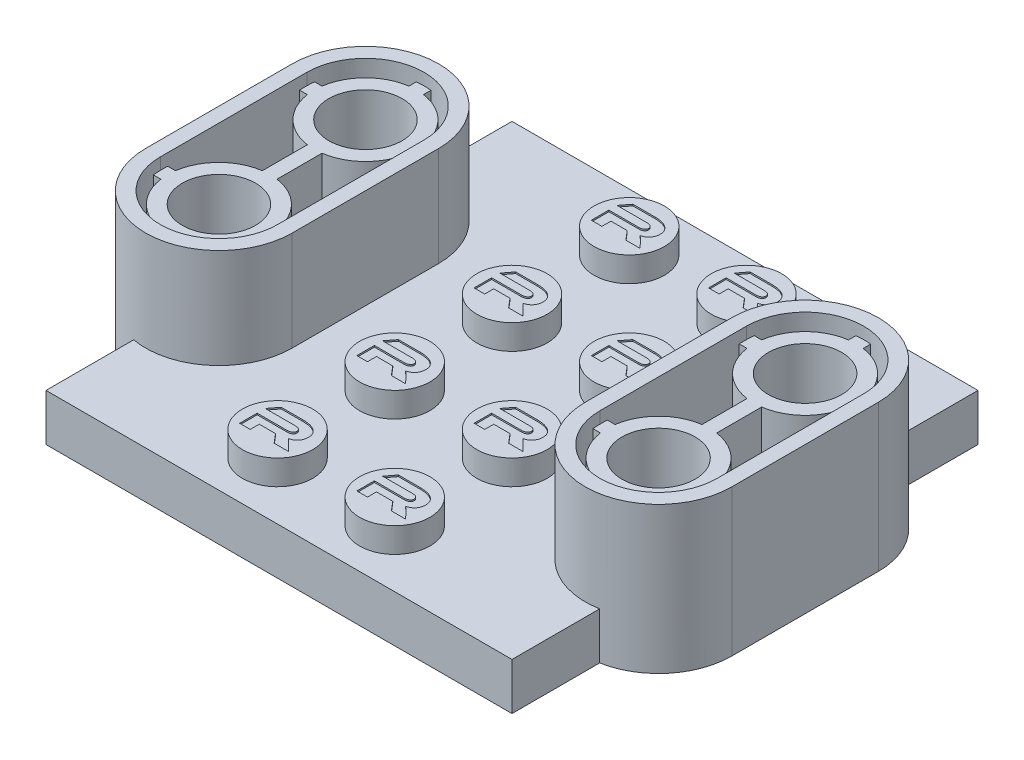
from build123d import *
from build123d.topology import SkipClean

# Parameters (mm, degrees)
SKETCH1_R              = 2.4
BOSS_EXTRUDE1_DEPTH    = 1.7
BOSS_EXTRUDE1_2_DEPTH  = 1.7
BOSS_EXTRUDE1_3_DEPTH  = 1.7
BOSS_EXTRUDE1_4_DEPTH  = 1.7
BOSS_EXTRUDE1_5_DEPTH  = 1.7
BOSS_EXTRUDE1_6_DEPTH  = 1.7
BOSS_EXTRUDE1_7_DEPTH  = 1.7
BOSS_EXTRUDE1_8_DEPTH  = 1.7
BOSS_EXTRUDE1_9_DEPTH  = 1.7
BOSS_EXTRUDE1_10_DEPTH = 1.7
BOSS_EXTRUDE1_11_DEPTH = 1.7
BOSS_EXTRUDE1_12_DEPTH = 1.7
BOSS_EXTRUDE1_13_DEPTH = 1.7
BOSS_EXTRUDE1_14_DEPTH = 1.7
BOSS_EXTRUDE1_15_DEPTH = 1.7
BOSS_EXTRUDE1_16_DEPTH = 1.7
SKETCH2_W              = 31.8
SKETCH2_H              = 31.8
BOSS_EXTRUDE2_DEPTH    = 3.2
SKETCH4_R              = 2.4
CUT_EXTRUDE1_DEPTH     = 8.2
BOSS_EXTRUDE3_DEPTH    = 3.2
SKETCH6_R              = 3.5
CUT_EXTRUDE2_DEPTH     = 2.1
SKETCH7_R              = 2.5
CUT_EXTRUDE3_DEPTH     = 13.5
SKETCH8_R              = 3.5
CUT_EXTRUDE4_DEPTH     = 0.8
SKETCH9_R              = 3.5
SKETCH9_R_2            = 2.5
BOSS_EXTRUDE4_DEPTH    = 6
BOSS_EXTRUDE5_DEPTH    = 6.8
SKETCH11_R             = 4
CUT_EXTRUDE5_DEPTH     = 10
BOSS_EXTRUDE6_DEPTH    = 2.1
SKETCH14_R             = 2.5
BOSS_EXTRUDE7_DEPTH    = 1.3
SKETCH15_R             = 2.4
CUT_EXTRUDE6_DEPTH     = 7
SKETCH16_R             = 3.256854249
SKETCH16_R_2           = 2.556854249
BOSS_EXTRUDE8_DEPTH    = 2.1
SKETCH17_R             = 1.1
CUT_EXTRUDE7_DEPTH     = 1.8
CUT_EXTRUDE8_START     = -2.1
SKETCH18_R             = 2.556854249
CUT_EXTRUDE8_DEPTH     = 2.1
CUT_EXTRUDE9_DEPTH     = 0.1
LPATTERN1_COUNT        = 2
LPATTERN1_PITCH        = 8
LPATTERN1_COUNT_DIR2   = 4
LPATTERN1_PITCH_DIR2   = 8


with BuildPart() as part:
    # Sketch1 → Boss-Extrude1 (new body)
    with BuildSketch(Plane(origin=(0, 0, 0), x_dir=(1, 0, 0), z_dir=(0, 1, 0))):
        with Locations(Location((12, 12, 0), (0, 0, 270))):
            Circle(SKETCH1_R)
    extrude(amount=BOSS_EXTRUDE1_DEPTH)



with BuildPart() as body_2:
    # Sketch1 → Boss-Extrude1 2 (new body)
    with BuildSketch(Plane(origin=(0, 0, 0), x_dir=(1, 0, 0), z_dir=(0, 1, 0))):
        with Locations(Location((4, 12, 0), (0, 0, 270))):
            Circle(SKETCH1_R)
    extrude(amount=BOSS_EXTRUDE1_2_DEPTH)


with BuildPart() as body_3:
    # Sketch1 → Boss-Extrude1 3 (new body)
    with BuildSketch(Plane(origin=(0, 0, 0), x_dir=(1, 0, 0), z_dir=(0, 1, 0))):
        with Locations(Location((-4, 12, 0), (0, 0, 270))):
            Circle(SKETCH1_R)
    extrude(amount=BOSS_EXTRUDE1_3_DEPTH)


with BuildPart() as body_4:
    # Sketch1 → Boss-Extrude1 4 (new body)
    with BuildSketch(Plane(origin=(0, 0, 0), x_dir=(1, 0, 0), z_dir=(0, 1, 0))):
        with Locations(Location((-12, 12, 0), (0, 0, 270))):
            Circle(SKETCH1_R)
    extrude(amount=BOSS_EXTRUDE1_4_DEPTH)


with BuildPart() as body_5:
    # Sketch1 → Boss-Extrude1 5 (new body)
    with BuildSketch(Plane(origin=(0, 0, 0), x_dir=(1, 0, 0), z_dir=(0, 1, 0))):
        with Locations(Location((4, 4, 0), (0, 0, 270))):
            Circle(SKETCH1_R)
    extrude(amount=BOSS_EXTRUDE1_5_DEPTH)


with BuildPart() as body_6:
    # Sketch1 → Boss-Extrude1 6 (new body)
    with BuildSketch(Plane(origin=(0, 0, 0), x_dir=(1, 0, 0), z_dir=(0, 1, 0))):
        with Locations(Location((-4, 4, 0), (0, 0, 270))):
            Circle(SKETCH1_R)
    extrude(amount=BOSS_EXTRUDE1_6_DEPTH)


with BuildPart() as body_7:
    # Sketch1 → Boss-Extrude1 7 (new body)
    with BuildSketch(Plane(origin=(0, 0, 0), x_dir=(1, 0, 0), z_dir=(0, 1, 0))):
        with Locations(Location((-12, 4, 0), (0, 0, 270))):
            Circle(SKETCH1_R)
    extrude(amount=BOSS_EXTRUDE1_7_DEPTH)


with BuildPart() as body_8:
    # Sketch1 → Boss-Extrude1 8 (new body)
    with BuildSketch(Plane(origin=(0, 0, 0), x_dir=(1, 0, 0), z_dir=(0, 1, 0))):
        with Locations(Location((4, -4, 0), (0, 0, 270))):
            Circle(SKETCH1_R)
    extrude(amount=BOSS_EXTRUDE1_8_DEPTH)


with BuildPart() as body_9:
    # Sketch1 → Boss-Extrude1 9 (new body)
    with BuildSketch(Plane(origin=(0, 0, 0), x_dir=(1, 0, 0), z_dir=(0, 1, 0))):
        with Locations(Location((-4, -4, 0), (0, 0, 270))):
            Circle(SKETCH1_R)
    extrude(amount=BOSS_EXTRUDE1_9_DEPTH)


with BuildPart() as body_10:
    # Sketch1 → Boss-Extrude1 10 (new body)
    with BuildSketch(Plane(origin=(0, 0, 0), x_dir=(1, 0, 0), z_dir=(0, 1, 0))):
        with Locations(Location((-12, -4, 0), (0, 0, 270))):
            Circle(SKETCH1_R)
    extrude(amount=BOSS_EXTRUDE1_10_DEPTH)


with BuildPart() as body_11:
    # Sketch1 → Boss-Extrude1 11 (new body)
    with BuildSketch(Plane(origin=(0, 0, 0), x_dir=(1, 0, 0), z_dir=(0, 1, 0))):
        with Locations(Location((4, -12, 0), (0, 0, 270))):
            Circle(SKETCH1_R)
    extrude(amount=BOSS_EXTRUDE1_11_DEPTH)


with BuildPart() as body_12:
    # Sketch1 → Boss-Extrude1 12 (new body)
    with BuildSketch(Plane(origin=(0, 0, 0), x_dir=(1, 0, 0), z_dir=(0, 1, 0))):
        with Locations(Location((-4, -12, 0), (0, 0, 270))):
            Circle(SKETCH1_R)
    extrude(amount=BOSS_EXTRUDE1_12_DEPTH)


with BuildPart() as body_13:
    # Sketch1 → Boss-Extrude1 13 (new body)
    with BuildSketch(Plane(origin=(0, 0, 0), x_dir=(1, 0, 0), z_dir=(0, 1, 0))):
        with Locations(Location((-12, -12, 0), (0, 0, 270))):
            Circle(SKETCH1_R)
    extrude(amount=BOSS_EXTRUDE1_13_DEPTH)


with BuildPart() as body_14:
    # Sketch1 → Boss-Extrude1 14 (new body)
    with BuildSketch(Plane(origin=(0, 0, 0), x_dir=(1, 0, 0), z_dir=(0, 1, 0))):
        with Locations(Location((12, 4, 0), (0, 0, 270))):
            Circle(SKETCH1_R)
    extrude(amount=BOSS_EXTRUDE1_14_DEPTH)


with BuildPart() as body_15:
    # Sketch1 → Boss-Extrude1 15 (new body)
    with BuildSketch(Plane(origin=(0, 0, 0), x_dir=(1, 0, 0), z_dir=(0, 1, 0))):
        with Locations(Location((12, -4, 0), (0, 0, 270))):
            Circle(SKETCH1_R)
    extrude(amount=BOSS_EXTRUDE1_15_DEPTH)


with BuildPart() as body_16:
    # Sketch1 → Boss-Extrude1 16 (new body)
    with BuildSketch(Plane(origin=(0, 0, 0), x_dir=(1, 0, 0), z_dir=(0, 1, 0))):
        with Locations(Location((12, -12, 0), (0, 0, 270))):
            Circle(SKETCH1_R)
    extrude(amount=BOSS_EXTRUDE1_16_DEPTH)


with BuildPart() as part_1:
    add(part.part)

    add(body_2.part)  # Boss-Extrude2 merges body 2

    add(body_3.part)  # Boss-Extrude2 merges body 3

    add(body_4.part)  # Boss-Extrude2 merges body 4

    add(body_5.part)  # Boss-Extrude2 merges body 5

    add(body_6.part)  # Boss-Extrude2 merges body 6

    add(body_7.part)  # Boss-Extrude2 merges body 7

    add(body_8.part)  # Boss-Extrude2 merges body 8

    add(body_9.part)  # Boss-Extrude2 merges body 9

    add(body_10.part)  # Boss-Extrude2 merges body 10

    add(body_11.part)  # Boss-Extrude2 merges body 11

    add(body_12.part)  # Boss-Extrude2 merges body 12

    add(body_13.part)  # Boss-Extrude2 merges body 13

    add(body_14.part)  # Boss-Extrude2 merges body 14

    add(body_15.part)  # Boss-Extrude2 merges body 15

    add(body_16.part)  # Boss-Extrude2 merges body 16
    # Sketch2 → Boss-Extrude2 (add)
    with BuildSketch(Plane(origin=(0, 0, 0), x_dir=(1, 0, 0), z_dir=(0, 1, 0))):
        Rectangle(SKETCH2_W, SKETCH2_H)
    extrude(amount=-BOSS_EXTRUDE2_DEPTH)

    # Sketch4 → Cut-Extrude1 (cut)
    with BuildSketch(Plane(origin=(0, 0, 0), x_dir=(1, 0, 0), z_dir=(0, 1, 0))):
        with Locations((12, -4)):
            Circle(SKETCH4_R)
        with Locations((12, 4)):
            Circle(SKETCH4_R)
        with Locations((-12, -4)):
            Circle(SKETCH4_R)
        with Locations((-12, 4)):
            Circle(SKETCH4_R)
    extrude(amount=CUT_EXTRUDE1_DEPTH, mode=Mode.SUBTRACT)

    # Sketch5 → Boss-Extrude3 (add)
    with BuildSketch(Plane.XZ.offset(3.2)):
        with BuildLine():
            ThreePointArc((-15.9, 9.918333051), (-18.840572874, 8.201562119), (-20, 5))
            ThreePointArc((-20, 5), (-18.840572874, 1.798437881), (-15.9, 0.081666949))
            Line((-15.9, 0.081666949), (-15.9, 9.918333051))
        make_face()
        with BuildLine():
            ThreePointArc((-10, 5), (-11.798437881, 8.840572874), (-15.9, 9.918333051))
            Line((-15.9, 9.918333051), (-15.9, 0.081666949))
            ThreePointArc((-15.9, 0.081666949), (-15.451848838, 0.020458593), (-15, 0))
            ThreePointArc((-15, 0), (-11.464466094, 1.464466094), (-10, 5))
        make_face()
        with BuildLine():
            ThreePointArc((-15.9, 0.081666949), (-18.840572874, 1.798437881), (-20, 5))
            Line((-20, 5), (-20, -5))
            ThreePointArc((-20, -5), (-18.840572874, -1.798437881), (-15.9, -0.081666949))
            Line((-15.9, -0.081666949), (-15.9, 0.081666949))
        make_face()
        with BuildLine():
            ThreePointArc((-15.9, -0.081666949), (-18.840572874, -1.798437881), (-20, -5))
            ThreePointArc((-20, -5), (-18.840572874, -8.201562119), (-15.9, -9.918333051))
            Line((-15.9, -9.918333051), (-15.9, -0.081666949))
        make_face()
        with BuildLine():
            ThreePointArc((-15, 0), (-15.451848838, -0.020458593), (-15.9, -0.081666949))
            Line((-15.9, -0.081666949), (-15.9, -9.918333051))
            ThreePointArc((-15.9, -9.918333051), (-11.798437881, -8.840572874), (-10, -5))
            ThreePointArc((-10, -5), (-11.464466094, -1.464466094), (-15, 0))
        make_face()
        with BuildLine():
            ThreePointArc((15.9, 0.081666949), (18.840572874, 1.798437881), (20, 5))
            ThreePointArc((20, 5), (18.840572874, 8.201562119), (15.9, 9.918333051))
            Line((15.9, 9.918333051), (15.9, 0.081666949))
        make_face()
        with BuildLine():
            Line((15.9, 0.081666949), (15.9, 9.918333051))
            ThreePointArc((15.9, 9.918333051), (10.020458593, 5.451848845), (14.999999987, 0))
            ThreePointArc((14.999999987, 0), (15.451848832, 0.020458592), (15.9, 0.081666949))
        make_face()
        with BuildLine():
            Line((20, -5), (20, 5))
            ThreePointArc((20, 5), (18.840572874, 1.798437881), (15.9, 0.081666949))
            Line((15.9, 0.081666949), (15.9, -0.081666949))
            ThreePointArc((15.9, -0.081666949), (18.840572874, -1.798437881), (20, -5))
        make_face()
        with BuildLine():
            ThreePointArc((15.9, -9.918333051), (18.840572874, -8.201562119), (20, -5))
            ThreePointArc((20, -5), (18.840572874, -1.798437881), (15.9, -0.081666949))
            Line((15.9, -0.081666949), (15.9, -9.918333051))
        make_face()
        with BuildLine():
            Line((15.9, -9.918333051), (15.9, -0.081666949))
            ThreePointArc((15.9, -0.081666949), (15.451848832, -0.020458592), (14.999999987, 0))
            ThreePointArc((14.999999987, 0), (10.020458593, -5.451848845), (15.9, -9.918333051))
        make_face()
    extrude(amount=-BOSS_EXTRUDE3_DEPTH)

    # Sketch6 → Cut-Extrude2 (cut)
    with BuildSketch(Plane.XZ.offset(3.2)):
        with BuildLine():
            Line((-19, 5), (-19, -5))
            ThreePointArc((-19, -5), (-17.792848009, -7.863564213), (-14.9, -8.998749805))
            Line((-14.9, -8.998749805), (-14.9, -14.9))
            Line((-14.9, -14.9), (14.9, -14.9))
            Line((14.9, -14.9), (14.9, -8.998749805))
            ThreePointArc((14.9, -8.998749805), (17.792848009, -7.863564213), (19, -5))
            Line((19, -5), (19, 5))
            ThreePointArc((19, 5), (17.792848009, 7.863564213), (14.9, 8.998749805))
            Line((14.9, 8.998749805), (14.9, 14.9))
            Line((14.9, 14.9), (-14.9, 14.9))
            Line((-14.9, 14.9), (-14.9, 8.998749805))
            ThreePointArc((-14.9, 8.998749805), (-17.792848009, 7.863564213), (-19, 5))
        make_face()
        with Locations(Location((-15, 5, 0), (0, 0, 270))):
            Circle(SKETCH6_R, mode=Mode.SUBTRACT)
        with Locations(Location((15, 5, 0), (0, 0, 270))):
            Circle(SKETCH6_R, mode=Mode.SUBTRACT)
        with Locations(Location((15, -5, 0), (0, 0, 270))):
            Circle(SKETCH6_R, mode=Mode.SUBTRACT)
        with Locations(Location((-15, -5, 0), (0, 0, 270))):
            Circle(SKETCH6_R, mode=Mode.SUBTRACT)
    extrude(amount=-CUT_EXTRUDE2_DEPTH, mode=Mode.SUBTRACT)

    # Sketch7 → Cut-Extrude3 (cut)
    with BuildSketch(Plane.XZ.offset(3.2)):
        with Locations(Location((-15, 5, 0), (0, 0, 270))):
            Circle(SKETCH7_R)
        with Locations(Location((-15, -5, 0), (0, 0, 270))):
            Circle(SKETCH7_R)
        with Locations(Location((15, -5, 0), (0, 0, 270))):
            Circle(SKETCH7_R)
        with Locations(Location((15, 5, 0), (0, 0, 270))):
            Circle(SKETCH7_R)
    extrude(amount=-CUT_EXTRUDE3_DEPTH, mode=Mode.SUBTRACT)

    # Sketch8 → Cut-Extrude4 (cut)
    with BuildSketch(Plane.XZ.offset(3.2)):
        with Locations(Location((-15, -5, 0), (0, 0, 270))):
            Circle(SKETCH8_R)
        with Locations(Location((15, -5, 0), (0, 0, 270))):
            Circle(SKETCH8_R)
        with Locations(Location((15, 5, 0), (0, 0, 270))):
            Circle(SKETCH8_R)
        with Locations(Location((-15, 5, 0), (0, 0, 270))):
            Circle(SKETCH8_R)
    extrude(amount=-CUT_EXTRUDE4_DEPTH, mode=Mode.SUBTRACT)

    # Sketch9 → Boss-Extrude4 (add)
    # profile 1 of 4: a face of its own
    with BuildSketch(Plane(origin=(0, 0, 0), x_dir=(1, 0, 0), z_dir=(0, 1, 0))):
        with Locations(Location((15, 5, 0), (0, 0, 90))):
            Circle(SKETCH9_R)
        with Locations(Location((15, 5, 0), (0, 0, 90))):
            Circle(SKETCH9_R_2, mode=Mode.SUBTRACT)
    # profile 2 of 4: a face of its own
    with BuildSketch(Plane(origin=(0, 0, 0), x_dir=(1, 0, 0), z_dir=(0, 1, 0))):
        with Locations(Location((15, -5, 0), (0, 0, 90))):
            Circle(SKETCH9_R)
        with Locations(Location((15, -5, 0), (0, 0, 90))):
            Circle(SKETCH9_R_2, mode=Mode.SUBTRACT)
    # profile 3 of 4: a face of its own
    with BuildSketch(Plane(origin=(0, 0, 0), x_dir=(1, 0, 0), z_dir=(0, 1, 0))):
        with Locations(Location((-15, -5, 0), (0, 0, 90))):
            Circle(SKETCH9_R)
        with Locations(Location((-15, -5, 0), (0, 0, 90))):
            Circle(SKETCH9_R_2, mode=Mode.SUBTRACT)
    # profile 4 of 4: a face of its own
    with BuildSketch(Plane(origin=(0, 0, 0), x_dir=(1, 0, 0), z_dir=(0, 1, 0))):
        with Locations(Location((-15, 5, 0), (0, 0, 90))):
            Circle(SKETCH9_R)
        with Locations(Location((-15, 5, 0), (0, 0, 90))):
            Circle(SKETCH9_R_2, mode=Mode.SUBTRACT)
    extrude(amount=BOSS_EXTRUDE4_DEPTH)

    # Sketch10 → Boss-Extrude5 (add)
    # profile 1 of 8: a face of its own
    with SkipClean():  # the faces are left unmerged after this step: merging them gives an invalid solid
        with BuildSketch(Plane(origin=(0, 0, 0), x_dir=(1, 0, 0), z_dir=(0, 1, 0))):
            with BuildLine():
                ThreePointArc((-15.9, 9.918333051), (-18.840572874, 8.201562119), (-20, 5))
                Line((-20, 5), (-20, -5))
                ThreePointArc((-20, -5), (-18.840572874, -8.201562119), (-15.9, -9.918333051))
                ThreePointArc((-15.9, -9.918333051), (-11.798437881, -8.840572874), (-10, -5))
                Line((-10, -5), (-10, 5))
                ThreePointArc((-10, 5), (-11.798437881, 8.840572874), (-15.9, 9.918333051))
            make_face()
            with BuildLine():
                Line((-19, 4.5), (-19, 5))
                ThreePointArc((-19, 5), (-18.992149037, 5.25049165), (-18.968626967, 5.5))
                ThreePointArc((-18.968626967, 5.5), (-17.828427125, 7.828427125), (-15.5, 8.968626967))
                ThreePointArc((-15.5, 8.968626967), (-15, 9), (-14.5, 8.968626967))
                ThreePointArc((-14.5, 8.968626967), (-12.171572875, 7.828427125), (-11.031373033, 5.5))
                ThreePointArc((-11.031373033, 5.5), (-11.007850963, 5.25049165), (-11, 5))
                Line((-11, 5), (-11, 4.5))
                Line((-11, 4.5), (-11, -4.5))
                Line((-11, -4.5), (-11, -5))
                ThreePointArc((-11, -5), (-11.007850963, -5.25049165), (-11.031373033, -5.5))
                ThreePointArc((-11.031373033, -5.5), (-12.171572875, -7.828427125), (-14.5, -8.968626967))
                ThreePointArc((-14.5, -8.968626967), (-15, -9), (-15.5, -8.968626967))
                ThreePointArc((-15.5, -8.968626967), (-17.828427125, -7.828427125), (-18.968626967, -5.5))
                ThreePointArc((-18.968626967, -5.5), (-18.992149037, -5.25049165), (-19, -5))
                Line((-19, -5), (-19, -4.5))
                Line((-19, -4.5), (-19, 4.5))
            make_face(mode=Mode.SUBTRACT)
        # profile 2 of 8: a face of its own
        with BuildSketch(Plane(origin=(0, 0, 0), x_dir=(1, 0, 0), z_dir=(0, 1, 0))):
            with BuildLine():
                ThreePointArc((-14.5, 8.968626967), (-15, 9), (-15.5, 8.968626967))
                Line((-15.5, 8.968626967), (-15.5, 8.464101615))
                ThreePointArc((-15.5, 8.464101615), (-15, 8.5), (-14.5, 8.464101615))
                Line((-14.5, 8.464101615), (-14.5, 8.968626967))
            make_face()
        # profile 3 of 8: a face of its own
        with BuildSketch(Plane(origin=(0, 0, 0), x_dir=(1, 0, 0), z_dir=(0, 1, 0))):
            with BuildLine():
                ThreePointArc((-11, 5), (-11.007850963, 5.25049165), (-11.031373033, 5.5))
                Line((-11.031373033, 5.5), (-11.535898385, 5.5))
                ThreePointArc((-11.535898385, 5.5), (-11.508986132, 5.250643519), (-11.5, 5))
                ThreePointArc((-11.5, 5), (-11.508986132, 4.749356481), (-11.535898385, 4.5))
                Line((-11.535898385, 4.5), (-11, 4.5))
                Line((-11, 4.5), (-11, 5))
            make_face()
        # profile 4 of 8: a face of its own
        with BuildSketch(Plane(origin=(0, 0, 0), x_dir=(1, 0, 0), z_dir=(0, 1, 0))):
            with BuildLine():
                ThreePointArc((-18.968626967, 5.5), (-18.992149037, 5.25049165), (-19, 5))
                Line((-19, 5), (-19, 4.5))
                Line((-19, 4.5), (-18.464101615, 4.5))
                ThreePointArc((-18.464101615, 4.5), (-18.5, 5), (-18.464101615, 5.5))
                Line((-18.464101615, 5.5), (-18.968626967, 5.5))
            make_face()
        # profile 5 of 8: a face of its own
        with BuildSketch(Plane(origin=(0, 0, 0), x_dir=(1, 0, 0), z_dir=(0, 1, 0))):
            with BuildLine():
                Line((-18.464101615, -4.5), (-19, -4.5))
                Line((-19, -4.5), (-19, -5))
                ThreePointArc((-19, -5), (-18.992149037, -5.25049165), (-18.968626967, -5.5))
                Line((-18.968626967, -5.5), (-18.464101615, -5.5))
                ThreePointArc((-18.464101615, -5.5), (-18.5, -5), (-18.464101615, -4.5))
            make_face()
        # profile 6 of 8: a face of its own
        with BuildSketch(Plane(origin=(0, 0, 0), x_dir=(1, 0, 0), z_dir=(0, 1, 0))):
            with BuildLine():
                Line((-11, -4.5), (-11.535898385, -4.5))
                ThreePointArc((-11.535898385, -4.5), (-11.508986132, -4.749356481), (-11.5, -5))
                ThreePointArc((-11.5, -5), (-11.508986132, -5.250643519), (-11.535898385, -5.5))
                Line((-11.535898385, -5.5), (-11.031373033, -5.5))
                ThreePointArc((-11.031373033, -5.5), (-11.007850963, -5.25049165), (-11, -5))
                Line((-11, -5), (-11, -4.5))
            make_face()
        # profile 7 of 8: a face of its own
        with BuildSketch(Plane(origin=(0, 0, 0), x_dir=(1, 0, 0), z_dir=(0, 1, 0))):
            with BuildLine():
                Line((-15.5, -8.464101615), (-15.5, -8.968626967))
                ThreePointArc((-15.5, -8.968626967), (-15, -9), (-14.5, -8.968626967))
                Line((-14.5, -8.968626967), (-14.5, -8.464101615))
                ThreePointArc((-14.5, -8.464101615), (-15, -8.5), (-15.5, -8.464101615))
            make_face()
        # profile 8 of 8: a face of its own
        with BuildSketch(Plane(origin=(0, 0, 0), x_dir=(1, 0, 0), z_dir=(0, 1, 0))):
            with BuildLine():
                ThreePointArc((-14.5, 1.535898385), (-15, 1.5), (-15.5, 1.535898385))
                Line((-15.5, 1.535898385), (-15.5, -1.535898385))
                ThreePointArc((-15.5, -1.535898385), (-15, -1.5), (-14.5, -1.535898385))
                Line((-14.5, -1.535898385), (-14.5, 1.535898385))
            make_face()
        boss_extrude5 = extrude(amount=BOSS_EXTRUDE5_DEPTH)

    # Mirror1: Boss-Extrude5 across plane
    with SkipClean():  # the faces are left unmerged after this step: merging them gives an invalid solid
        add(boss_extrude5.mirror(Plane(origin=(0, 0, 0), x_dir=(0, 0, 1), z_dir=(1, 0, 0))))

    # Sketch11 → Cut-Extrude5 (cut)
    with SkipClean():  # the faces are left unmerged after this step: merging them gives an invalid solid
        with BuildSketch(Plane(origin=(0, 6, 0), x_dir=(1, 0, 0), z_dir=(0, 1, 0))):
            with BuildLine():
                ThreePointArc((-11, 5), (-15, 9), (-19, 5))
                ThreePointArc((-19, 5), (-15, 1), (-11, 5))
            make_face()
            with Locations((-15, -5)):
                Circle(SKETCH11_R)
            with BuildLine():
                Line((-19, 5), (-19, -5))
                ThreePointArc((-19, -5), (-15, -1), (-11, -5))
                Line((-11, -5), (-11, 5))
                ThreePointArc((-11, 5), (-15, 1), (-19, 5))
            make_face()
            with BuildLine():
                Line((19, -5), (19, 5))
                ThreePointArc((19, 5), (15, 1), (11, 5))
                Line((11, 5), (11, -5))
                ThreePointArc((11, -5), (15, -1), (19, -5))
            make_face()
            with Locations((15, 5)):
                Circle(SKETCH11_R)
            with Locations((15, -5)):
                Circle(SKETCH11_R)
        extrude(amount=CUT_EXTRUDE5_DEPTH, mode=Mode.SUBTRACT)

    # Sketch12 → Boss-Extrude6 (add)
    # profile 1 of 2: a face of its own
    with SkipClean():  # the faces are left unmerged after this step: merging them gives an invalid solid
        with BuildSketch(Plane.XZ.offset(3.2)):
            with BuildLine():
                Line((-10, -5), (-10, 5))
                ThreePointArc((-10, 5), (-15, 10), (-20, 5))
                Line((-20, 5), (-20, -5))
                ThreePointArc((-20, -5), (-15, -10), (-10, -5))
            make_face()
            with BuildLine():
                Line((-19, 5), (-19, -5))
                ThreePointArc((-19, -5), (-15, -9), (-11, -5))
                Line((-11, -5), (-11, 5))
                ThreePointArc((-11, 5), (-15, 9), (-19, 5))
            make_face(mode=Mode.SUBTRACT)
        # profile 2 of 2: a face of its own
        with BuildSketch(Plane.XZ.offset(3.2)):
            with BuildLine():
                Line((10, 5), (10, -5))
                ThreePointArc((10, -5), (15, -10), (20, -5))
                Line((20, -5), (20, 5))
                ThreePointArc((20, 5), (15, 10), (10, 5))
            make_face()
            with BuildLine():
                Line((19, -5), (19, 5))
                ThreePointArc((19, 5), (15, 9), (11, 5))
                Line((11, 5), (11, -5))
                ThreePointArc((11, -5), (15, -9), (19, -5))
            make_face(mode=Mode.SUBTRACT)
        extrude(amount=-BOSS_EXTRUDE6_DEPTH)

    # Sketch14 → Boss-Extrude7 (add)
    with SkipClean():  # the faces are left unmerged after this step: merging them gives an invalid solid
        with BuildSketch(Plane.XZ.offset(2.4)):
            with BuildLine():
                Line((-11.031373033, 5.5), (-11.535898385, 5.5))
                ThreePointArc((-11.535898385, 5.5), (-12.525126266, 7.474873734), (-14.5, 8.464101615))
                Line((-14.5, 8.464101615), (-14.5, 8.968626967))
                ThreePointArc((-14.5, 8.968626967), (-15, 9), (-15.5, 8.968626967))
                Line((-15.5, 8.968626967), (-15.5, 8.464101615))
                ThreePointArc((-15.5, 8.464101615), (-17.474873734, 7.474873734), (-18.464101615, 5.5))
                Line((-18.464101615, 5.5), (-18.968626967, 5.5))
                ThreePointArc((-18.968626967, 5.5), (-18.992149037, 5.25049165), (-19, 5))
                Line((-19, 5), (-19, 4.5))
                Line((-19, 4.5), (-18.464101615, 4.5))
                ThreePointArc((-18.464101615, 4.5), (-17.474873734, 2.525126266), (-15.5, 1.535898385))
                Line((-15.5, 1.535898385), (-15.5, -1.535898385))
                ThreePointArc((-15.5, -1.535898385), (-17.474873734, -2.525126266), (-18.464101615, -4.5))
                Line((-18.464101615, -4.5), (-19, -4.5))
                Line((-19, -4.5), (-19, -5))
                ThreePointArc((-19, -5), (-18.992149037, -5.25049165), (-18.968626967, -5.5))
                Line((-18.968626967, -5.5), (-18.464101615, -5.5))
                ThreePointArc((-18.464101615, -5.5), (-17.474873734, -7.474873734), (-15.5, -8.464101615))
                Line((-15.5, -8.464101615), (-15.5, -8.968626967))
                ThreePointArc((-15.5, -8.968626967), (-15, -9), (-14.5, -8.968626967))
                Line((-14.5, -8.968626967), (-14.5, -8.464101615))
                ThreePointArc((-14.5, -8.464101615), (-12.525126266, -7.474873734), (-11.535898385, -5.5))
                Line((-11.535898385, -5.5), (-11.031373033, -5.5))
                ThreePointArc((-11.031373033, -5.5), (-11.007850963, -5.25049165), (-11, -5))
                Line((-11, -5), (-11, -4.5))
                Line((-11, -4.5), (-11.535898385, -4.5))
                ThreePointArc((-11.535898385, -4.5), (-12.525126266, -2.525126266), (-14.5, -1.535898385))
                Line((-14.5, -1.535898385), (-14.5, 1.535898385))
                ThreePointArc((-14.5, 1.535898385), (-12.525126266, 2.525126266), (-11.535898385, 4.5))
                Line((-11.535898385, 4.5), (-11, 4.5))
                Line((-11, 4.5), (-11, 5))
                ThreePointArc((-11, 5), (-11.007850963, 5.25049165), (-11.031373033, 5.5))
            make_face()
            with Locations(Location((-15, 5, 0), (0, 0, 270))):
                Circle(SKETCH14_R, mode=Mode.SUBTRACT)
            with Locations(Location((-15, -5, 0), (0, 0, 270))):
                Circle(SKETCH14_R, mode=Mode.SUBTRACT)
        boss_extrude7 = extrude(amount=-BOSS_EXTRUDE7_DEPTH)

    # Mirror2: Boss-Extrude7 across plane
    with SkipClean():  # the faces are left unmerged after this step: merging them gives an invalid solid
        add(boss_extrude7.mirror(Plane(origin=(0, 0, 0), x_dir=(0, 0, 1), z_dir=(1, 0, 0))))

    # Sketch15 → Cut-Extrude6 (cut)
    with SkipClean():  # the faces are left unmerged after this step: merging them gives an invalid solid
        with BuildSketch(Plane(origin=(0, 0, 0), x_dir=(1, 0, 0), z_dir=(0, 1, 0))):
            with Locations((12, -12)):
                Circle(SKETCH15_R)
            with Locations((-12, -12)):
                Circle(SKETCH15_R)
            with Locations((-12, 12)):
                Circle(SKETCH15_R)
            with Locations((12, 12)):
                Circle(SKETCH15_R)
        extrude(amount=CUT_EXTRUDE6_DEPTH, mode=Mode.SUBTRACT)

    # Sketch16 → Boss-Extrude8 (add)
    # profile 1 of 7: a face of its own
    with SkipClean():  # the faces are left unmerged after this step: merging them gives an invalid solid
        with BuildSketch(Plane.XZ.offset(1.1)):
            with BuildLine():
                Line((-14.9, 14.9), (-14.9, 9.9989999))
                ThreePointArc((-14.9, 9.9989999), (-11.429285786, 8.5), (-10, 5))
                Line((-10, 5), (-10, 3.515315154))
                ThreePointArc((-10, 3.515315154), (-9.820152229, 4.388881219), (-9.791765012, 5.28031661))
                ThreePointArc((-9.791765012, 5.28031661), (-5.006478603, 9.282937742), (-11.205125912, 8.578158709))
                ThreePointArc((-11.205125912, 8.578158709), (-12.660956861, 9.661884414), (-14.4, 10.181147469))
                Line((-14.4, 10.181147469), (-14.4, 14.4))
                Line((-14.4, 14.4), (14.4, 14.4))
                Line((14.4, 14.4), (14.4, 10.181147469))
                ThreePointArc((14.4, 10.181147469), (12.660956861, 9.661884414), (11.205125912, 8.578158709))
                ThreePointArc((11.205125912, 8.578158709), (5.006478603, 9.282937742), (9.791765012, 5.28031661))
                ThreePointArc((9.791765012, 5.28031661), (9.820152229, 4.388881219), (10, 3.515315154))
                Line((10, 3.515315154), (10, 5))
                ThreePointArc((10, 5), (11.429285786, 8.5), (14.9, 9.9989999))
                Line((14.9, 9.9989999), (14.9, 14.9))
                Line((14.9, 14.9), (-14.9, 14.9))
            make_face()
            with BuildLine():
                ThreePointArc((9.966121544, 6.365414509), (5.649880124, 9.007194233), (10.539611248, 7.703557152))
                ThreePointArc((10.539611248, 7.703557152), (10.205948072, 7.054593683), (9.966121544, 6.365414509))
            make_face(mode=Mode.SUBTRACT)
            with BuildLine():
                ThreePointArc((-10.539611248, 7.703557152), (-5.649880124, 9.007194233), (-9.966121544, 6.365414509))
                ThreePointArc((-9.966121544, 6.365414509), (-10.205948072, 7.054593683), (-10.539611248, 7.703557152))
            make_face(mode=Mode.SUBTRACT)
        # profile 2 of 7: a face of its own
        with BuildSketch(Plane.XZ.offset(1.1)):
            with BuildLine():
                Line((-14.4, -14.4), (-14.4, -10.181147469))
                ThreePointArc((-14.4, -10.181147469), (-12.660956861, -9.661884414), (-11.205125912, -8.578158709))
                ThreePointArc((-11.205125912, -8.578158709), (-5.006478603, -9.282937742), (-9.791765012, -5.28031661))
                ThreePointArc((-9.791765012, -5.28031661), (-9.820152229, -4.388881219), (-10, -3.515315154))
                Line((-10, -3.515315154), (-10, -5))
                ThreePointArc((-10, -5), (-11.429285786, -8.5), (-14.9, -9.9989999))
                Line((-14.9, -9.9989999), (-14.9, -14.9))
                Line((-14.9, -14.9), (14.9, -14.9))
                Line((14.9, -14.9), (14.9, -9.9989999))
                ThreePointArc((14.9, -9.9989999), (11.429285786, -8.5), (10, -5))
                Line((10, -5), (10, -3.515315154))
                ThreePointArc((10, -3.515315154), (9.820152229, -4.388881219), (9.791765012, -5.28031661))
                ThreePointArc((9.791765012, -5.28031661), (5.006478603, -9.282937742), (11.205125912, -8.578158709))
                ThreePointArc((11.205125912, -8.578158709), (12.660956861, -9.661884414), (14.4, -10.181147469))
                Line((14.4, -10.181147469), (14.4, -14.4))
                Line((14.4, -14.4), (-14.4, -14.4))
            make_face()
            with BuildLine():
                ThreePointArc((10.539611248, -7.703557152), (5.649880124, -9.007194233), (9.966121544, -6.365414509))
                ThreePointArc((9.966121544, -6.365414509), (10.205948072, -7.054593683), (10.539611248, -7.703557152))
            make_face(mode=Mode.SUBTRACT)
            with BuildLine():
                ThreePointArc((-9.966121544, -6.365414509), (-5.649880124, -9.007194233), (-10.539611248, -7.703557152))
                ThreePointArc((-10.539611248, -7.703557152), (-10.205948072, -7.054593683), (-9.966121544, -6.365414509))
            make_face(mode=Mode.SUBTRACT)
        # profile 3 of 7: a face of its own
        with BuildSketch(Plane.XZ.offset(1.1)):
            with BuildLine():
                Line((10, 1.592954379), (10, 2.570427903))
                ThreePointArc((10, 2.570427903), (4.743145751, 0), (10, -2.570427903))
                Line((10, -2.570427903), (10, -1.592954379))
                ThreePointArc((10, -1.592954379), (5.443145751, 0), (10, 1.592954379))
            make_face()
        # profile 4 of 7: a face of its own
        with BuildSketch(Plane.XZ.offset(1.1)):
            with BuildLine():
                ThreePointArc((-10, -2.570427903), (-4.743145751, 0), (-10, 2.570427903))
                Line((-10, 2.570427903), (-10, 1.592954379))
                ThreePointArc((-10, 1.592954379), (-5.443145751, 0), (-10, -1.592954379))
                Line((-10, -1.592954379), (-10, -2.570427903))
            make_face()
        # profile 5 of 7: a face of its own
        with BuildSketch(Plane.XZ.offset(1.1)):
            with Locations(Location((0, 8, 0), (0, 0, 90))):
                Circle(SKETCH16_R)
            with Locations(Location((0, 8, 0), (0, 0, 90))):
                Circle(SKETCH16_R_2, mode=Mode.SUBTRACT)
        # profile 6 of 7: a face of its own
        with BuildSketch(Plane.XZ.offset(1.1)):
            with Locations(Location((0, 0, 0), (0, 0, 90))):
                Circle(SKETCH16_R)
            with Locations(Location((0, 0, 0), (0, 0, 90))):
                Circle(SKETCH16_R_2, mode=Mode.SUBTRACT)
        # profile 7 of 7: a face of its own
        with BuildSketch(Plane.XZ.offset(1.1)):
            with Locations(Location((0, -8, 0), (0, 0, 90))):
                Circle(SKETCH16_R)
            with Locations(Location((0, -8, 0), (0, 0, 90))):
                Circle(SKETCH16_R_2, mode=Mode.SUBTRACT)
        extrude(amount=BOSS_EXTRUDE8_DEPTH)

    # Sketch17 → Cut-Extrude7 (cut)
    with SkipClean():  # the faces are left unmerged after this step: merging them gives an invalid solid
        with BuildSketch(Plane.XZ.offset(1.1)):
            with Locations(Location((-4, 4, 0), (0, 0, 270))):
                Circle(SKETCH17_R)
            with Locations(Location((-4, -4, 0), (0, 0, 270))):
                Circle(SKETCH17_R)
            with Locations(Location((-4, -12, 0), (0, 0, 270))):
                Circle(SKETCH17_R)
            with Locations(Location((4, -12, 0), (0, 0, 270))):
                Circle(SKETCH17_R)
            with Locations(Location((4, -4, 0), (0, 0, 270))):
                Circle(SKETCH17_R)
            with Locations(Location((4, 4, 0), (0, 0, 270))):
                Circle(SKETCH17_R)
            with Locations(Location((-4, 12, 0), (0, 0, 270))):
                Circle(SKETCH17_R)
            with Locations(Location((4, 12, 0), (0, 0, 270))):
                Circle(SKETCH17_R)
        extrude(amount=-CUT_EXTRUDE7_DEPTH, mode=Mode.SUBTRACT)

    # Sketch18 → Cut-Extrude8 (cut)
    with SkipClean():  # the faces are left unmerged after this step: merging them gives an invalid solid
        with BuildSketch(Plane.XZ.offset(3.2).offset(CUT_EXTRUDE8_START)):
            with Locations(Location((-8, 8, 0), (0, 0, 90))):
                Circle(SKETCH18_R)
            with Locations(Location((-8, 0, 0), (0, 0, 90))):
                Circle(SKETCH18_R)
            with Locations(Location((8, 0, 0), (0, 0, 90))):
                Circle(SKETCH18_R)
            with Locations(Location((8, 8, 0), (0, 0, 90))):
                Circle(SKETCH18_R)
            with Locations(Location((-8, -8, 0), (0, 0, 90))):
                Circle(SKETCH18_R)
            with Locations(Location((8, -8, 0), (0, 0, 90))):
                Circle(SKETCH18_R)
        extrude(amount=CUT_EXTRUDE8_DEPTH, mode=Mode.SUBTRACT)

    # Sketch19 → Cut-Extrude9 (cut)
    with SkipClean():  # the faces are left unmerged after this step: merging them gives an invalid solid
        with BuildSketch(Plane(origin=(0, 1.7, 0), x_dir=(1, 0, 0), z_dir=(0, 1, 0))):
            with BuildLine():
                Line((-2.322887464, 11.062778068), (-3.292427945, 11.062778068))
                Line((-3.292427945, 11.062778068), (-3.813904026, 11.678423616))
                Line((-3.813904026, 11.678423616), (-4.926723857, 11.678423616))
                Line((-4.926723857, 11.678423616), (-4.926723857, 11.062778068))
                Line((-4.926723857, 11.062778068), (-5.65071492, 11.062778068))
                Line((-5.65071492, 11.062778068), (-5.65071492, 12.261666766))
                Line((-5.65071492, 12.261666766), (-3.614426768, 12.261666766))
                add(Edge.make_bspline(
                    [(-3.614426768, 12.261666766), (-3.587355724, 12.262444571), (-3.535203148, 12.263943017), (-3.460345258, 12.278146614), (-3.391882711, 12.299983974), (-3.340438676, 12.326395564), (-3.304029326, 12.351599947), (-3.280239939, 12.372147329), (-3.260095935, 12.394753481), (-3.243852908, 12.419184762), (-3.231095084, 12.445227227), (-3.221766645, 12.472752554), (-3.216827463, 12.502147259), (-3.215932165, 12.522219474), (-3.215472251, 12.532530556)],
                    knots=[0, 0, 0, 0, 1.812387576, 3.491578827, 5.086665683, 6.61424983, 7.345269948, 8.050644702, 8.715603598, 9.368037876, 10.010396105, 10.65414666, 11.308636162, 12, 12, 12, 12], degree=3))
                add(Edge.make_bspline(
                    [(-3.215472251, 12.532530556), (-3.215686714, 12.544031056), (-3.216102163, 12.566309338), (-3.221518643, 12.598510181), (-3.229269347, 12.6285868), (-3.241223339, 12.656197294), (-3.255993256, 12.68169079), (-3.273707931, 12.705304325), (-3.295413383, 12.726210384), (-3.329167008, 12.751464445), (-3.379127188, 12.77788399), (-3.448516815, 12.799027768), (-3.528027095, 12.812258032), (-3.584497497, 12.813744724), (-3.614426768, 12.81453267)],
                    knots=[0, 0, 0, 0, 0.747467353, 1.447962166, 2.119271411, 2.763820045, 3.398565086, 4.033310127, 4.677858761, 5.352125526, 6.771968283, 8.327855235, 10.053766036, 12, 12, 12, 12], degree=3))
                Line((-3.614426768, 12.81453267), (-5.65071492, 12.81453267))
                Line((-5.65071492, 12.81453267), (-5.178348723, 13.428153068))
                Line((-5.178348723, 13.428153068), (-3.6736624, 13.428153068))
                add(Edge.make_bspline(
                    [(-3.6736624, 13.428153068), (-3.640072359, 13.427550157), (-3.572326137, 13.426334175), (-3.469868299, 13.420041988), (-3.365954014, 13.407164941), (-3.260997499, 13.391771644), (-3.157188658, 13.370087727), (-3.057355443, 13.340067638), (-2.962187105, 13.303196798), (-2.872441816, 13.258635176), (-2.788303459, 13.20662092), (-2.711613177, 13.145685698), (-2.642502728, 13.076114593), (-2.591958352, 13.011231464), (-2.555959259, 12.955171249), (-2.533254807, 12.909499329), (-2.513387547, 12.861360658), (-2.497130266, 12.81024676), (-2.485294136, 12.756116845), (-2.475866376, 12.699381962), (-2.471107719, 12.639437474), (-2.470183624, 12.598523211), (-2.469710827, 12.57759014)],
                    knots=[0, 0, 0, 0, 1.213587286, 2.447628836, 3.705947961, 4.994965866, 6.27917396, 7.532891619, 8.756725992, 9.961815427, 11.147644327, 12.323511341, 13.491767691, 14.682007742, 15.28752907, 15.895531239, 16.521603963, 17.167517038, 17.830103594, 18.521674041, 19.243640218, 20, 20, 20, 20], degree=3))
                add(Edge.make_bspline(
                    [(-2.469710827, 12.57759014), (-2.470145791, 12.554781912), (-2.471008873, 12.509524464), (-2.479474854, 12.442659254), (-2.492635466, 12.377495284), (-2.510720768, 12.314255151), (-2.534146484, 12.253554974), (-2.5617237, 12.195486535), (-2.595266284, 12.141287366), (-2.63190677, 12.089380974), (-2.673553013, 12.041349619), (-2.719484917, 11.996774838), (-2.770160834, 11.956499915), (-2.824894545, 11.919831236), (-2.883829286, 11.888093141), (-2.946257865, 11.860400609), (-3.012818176, 11.83862842), (-3.058931285, 11.828406247), (-3.08231865, 11.823221828)],
                    knots=[0, 0, 0, 0, 1.034644272, 2.053002915, 3.053346374, 4.049606242, 5.033871284, 6.00327445, 6.962121959, 7.922772419, 8.883911231, 9.842605792, 10.823408254, 11.817516784, 12.828504822, 13.857321667, 14.913289483, 16, 16, 16, 16], degree=3))
                add(Edge.make_bspline(
                    [(-3.08231865, 11.823221828), (-3.060996624, 11.80627251), (-3.014978017, 11.76969137), (-2.958722399, 11.716814582), (-2.906951407, 11.66799955), (-2.861439023, 11.623036744), (-2.809240582, 11.572126926), (-2.772606211, 11.535684517), (-2.753231803, 11.516411629)],
                    knots=[0, 0, 0, 0, 1.088638157, 2.349570917, 3.084604163, 3.933955212, 4.907354111, 6, 6, 6, 6], degree=3))
                Line((-2.753231803, 11.516411629), (-2.322887464, 11.062778068))
            make_face()
        cut_extrude9 = extrude(amount=-CUT_EXTRUDE9_DEPTH, mode=Mode.SUBTRACT)

    # LPattern1: Cut-Extrude9 2 × 4
    with SkipClean():  # the faces are left unmerged after this step: merging them gives an invalid solid
        with Locations(*[(i * LPATTERN1_PITCH, 0, j * LPATTERN1_PITCH_DIR2) for i in range(LPATTERN1_COUNT) for j in range(LPATTERN1_COUNT_DIR2) if (i, j) != (0, 0)]):
            add(cut_extrude9, mode=Mode.SUBTRACT)


solid = part_1.part
